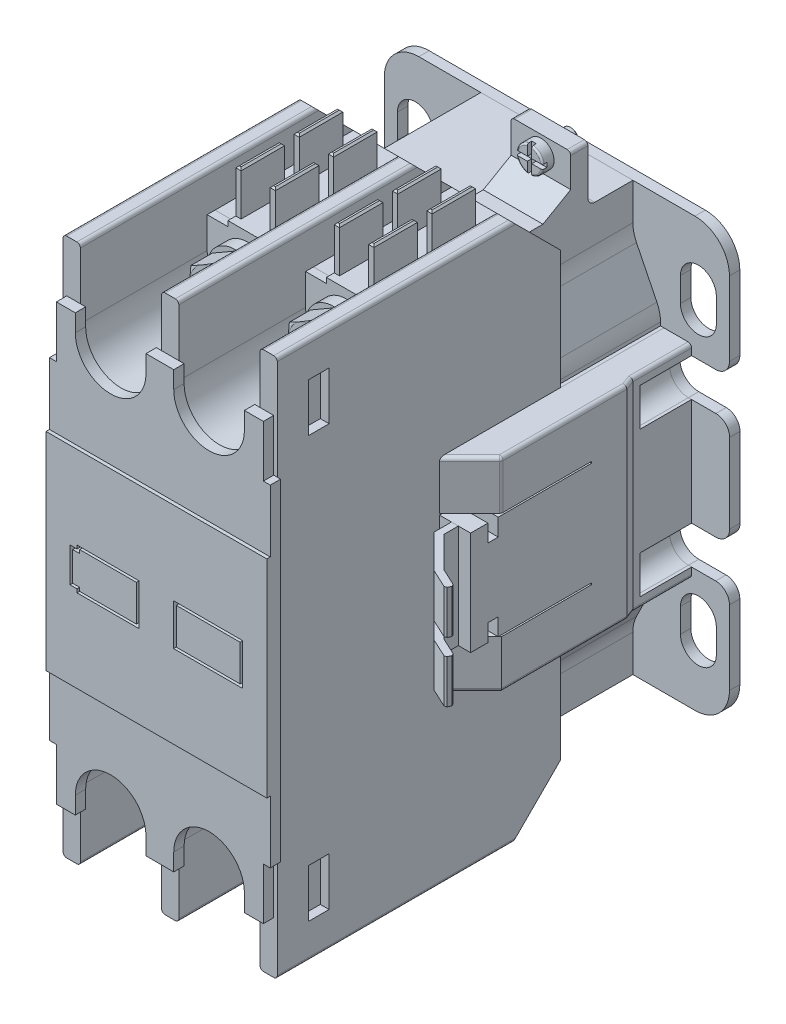
from build123d import *

# Parameters (mm, degrees)
BOSS_EXTRUDE1_DEPTH       = 27.75025
BOSS_EXTRUDE1_DEPTH_BACK  = 13.24975
BOSS_EXTRUDE2_START       = -29.75
BOSS_EXTRUDE2_DEPTH       = 1.50114
BOSS_EXTRUDE3_START       = -13.24975
BOSS_EXTRUDE3_DEPTH       = 14.99911
BOSS_EXTRUDE4_DEPTH       = 21.5011
CUT_EXTRUDE4_START        = -1.27
CUT_EXTRUDE4_DEPTH        = 1.27
SKETCH16_W                = 5.7404
SKETCH16_H                = 0.889
CUT_EXTRUDE5_DEPTH        = 14.732
BOSS_EXTRUDE5_DEPTH       = 1.143
SKETCH10_R                = 4.0005
BOSS_EXTRUDE6_DEPTH       = 1.84912
BOSS_EXTRUDE7_DEPTH       = 3.2258
SKETCH12_OUTSIDE_W        = 559.38
SKETCH12_OUTSIDE_H        = 587.34
SKETCH12_OUTSIDE_R        = 3.288568281
CUT_EXTRUDE3_DEPTH        = 65.048728331
CUT_EXTRUDE3_DRAFT        = -75
SKETCH13_W                = 6.577136562
SKETCH13_H                = 0.762
SKETCH13_W_2              = 0.762
SKETCH13_H_2              = 3.556
CUT_EXTRUDE_THIN1_DEPTH   = 1.27
CUT_EXTRUDE1_DEPTH        = 56.063220588
CUT_EXTRUDE1_DEPTH_BACK   = 56.063220588
SKETCH17_W                = 5.7404
SKETCH17_H                = 1.651
BOSS_EXTRUDE9_DEPTH       = 15.875
SKETCH18_W                = 0.762
SKETCH18_H                = 6.2992
BOSS_EXTRUDE10_DEPTH      = 6.2992
CHAMFER1_SIZE             = 0.254
BOSS_EXTRUDE11_DEPTH      = 15.9889
BOSS_EXTRUDE11_DEPTH_BACK = 15.9889
SKETCH20_W                = 1
SKETCH20_H                = 7.493
CUT_EXTRUDE6_DEPTH        = 76.843305776
BOSS_EXTRUDE12_DEPTH      = 14.732
CUT_EXTRUDE7_DEPTH        = 7.23392
CUT_EXTRUDE8_DEPTH        = 7.493
CUT_EXTRUDE9_DEPTH        = 68.509757213
SKETCH26_R                = 0.75
CUT_EXTRUDE10_DEPTH       = 63.278475094
CUT_EXTRUDE11_DEPTH       = 63.278475094
CUT_EXTRUDE11_DEPTH_BACK  = 63.278475094
SKETCH27_W                = 9.396731614
SKETCH27_H                = 2.405095086
FILLET4_R                 = 0.508
SKETCH28_W                = 10
SKETCH28_H                = 6
CUT_EXTRUDE12_DEPTH       = 7.493
BOSS_EXTRUDE18_REACH      = 78.333
SKETCH36_W                = 1
SKETCH36_H                = 0.5
SKETCH29_W                = 9.238
SKETCH29_H                = 5.238
BOSS_EXTRUDE13_DEPTH      = 7.112
BOSS_EXTRUDE13_2_DEPTH    = 7.112
BOSS_EXTRUDE14_DEPTH      = 8.636
BOSS_EXTRUDE15_DEPTH      = 1.651
BOSS_EXTRUDE15_DEPTH_BACK = 2.481599
SKETCH31_R                = 1.905
SKETCH33_R                = 1.651
BOSS_EXTRUDE16_DEPTH      = 0.635
SKETCH34_R                = 1.143
BOSS_EXTRUDE17_DEPTH      = 1.27
FILLET1_R                 = 0.254
CHAMFER2_SIZE             = 0.127
SKETCH32_W                = 0.635
SKETCH32_H                = 3.81
SKETCH32_W_2              = 3.81
SKETCH32_H_2              = 0.635
CUT_EXTRUDE_THIN2_DEPTH   = 0.635
FILLET2_R                 = 0.508
FILLET3_R                 = 0.508
SKETCH35_W                = 2.99974
SKETCH35_H                = 7.00024
CUT_EXTRUDE13_DEPTH       = 1.27


with BuildPart() as part:
    # Sketch4 → Boss-Extrude1 (new, two sides: drawn at the far end of the back side and taken through both)
    with BuildSketch(Plane.XY.offset(-BOSS_EXTRUDE1_DEPTH_BACK)):
        with BuildLine():
            Line((-15.5063, -38.9993), (-15.5063, 38.9993))
            Line((-15.5063, 38.9993), (-13.0063, 38.9993))
            Line((-13.0063, 38.9993), (-13.0063, 28.9993))
            ThreePointArc((-13.0063, 28.9993), (-7.12815, 23.12115), (-1.25, 28.9993))
            Line((-1.25, 28.9993), (-1.25, 38.9993))
            Line((-1.25, 38.9993), (1.25, 38.9993))
            Line((1.25, 38.9993), (1.25, 28.9993))
            ThreePointArc((1.25, 28.9993), (7.12815, 23.12115), (13.0063, 28.9993))
            Line((13.0063, 28.9993), (13.0063, 38.9993))
            Line((13.0063, 38.9993), (15.5063, 38.9993))
            Line((15.5063, 38.9993), (15.5063, -38.9993))
            Line((15.5063, -38.9993), (13.0063, -38.9993))
            Line((13.0063, -38.9993), (13.0063, -28.9993))
            ThreePointArc((13.0063, -28.9993), (7.12815, -23.12115), (1.25, -28.9993))
            Line((1.25, -28.9993), (1.25, -38.9993))
            Line((1.25, -38.9993), (-1.25, -38.9993))
            Line((-1.25, -38.9993), (-1.25, -28.9993))
            ThreePointArc((-1.25, -28.9993), (-7.12815, -23.12115), (-13.0063, -28.9993))
            Line((-13.0063, -28.9993), (-13.0063, -38.9993))
            Line((-13.0063, -38.9993), (-15.5063, -38.9993))
        make_face()
    extrude(amount=BOSS_EXTRUDE1_DEPTH + BOSS_EXTRUDE1_DEPTH_BACK)

    # Sketch7 → Boss-Extrude3 (add)
    with BuildSketch(Plane.XY.offset(BOSS_EXTRUDE3_START)):
        with BuildLine():
            Line((11.0063, -30.9993), (-11.0063, -30.9993))
            Line((-11.0063, -30.9993), (-11.0063, -25.666452457))
            ThreePointArc((-11.0063, -25.666452457), (-11.137198656, -24.529855738), (-11.523040841, -23.452770611))
            Line((-11.523040841, -23.452770611), (-14.489559159, -17.444829389))
            ThreePointArc((-14.489559159, -17.444829389), (-14.875401344, -16.367744262), (-15.0063, -15.231147543))
            Line((-15.0063, -15.231147543), (-15.0063, -14.731147543))
            Line((-15.0063, -14.731147543), (-15.5063, -14.731147543))
            Line((-15.5063, -14.731147543), (-15.5063, 14.731147543))
            Line((-15.5063, 14.731147543), (-15.0063, 14.731147543))
            Line((-15.0063, 14.731147543), (-15.0063, 15.231147543))
            ThreePointArc((-15.0063, 15.231147543), (-14.875401344, 16.367744262), (-14.489559159, 17.444829389))
            Line((-14.489559159, 17.444829389), (-11.523040841, 23.452770611))
            ThreePointArc((-11.523040841, 23.452770611), (-11.137198656, 24.529855738), (-11.0063, 25.666452457))
            Line((-11.0063, 25.666452457), (-11.0063, 30.9993))
            Line((-11.0063, 30.9993), (11.0063, 30.9993))
            Line((11.0063, 30.9993), (11.0063, 25.666452457))
            ThreePointArc((11.0063, 25.666452457), (11.137198656, 24.529855738), (11.523040841, 23.452770611))
            Line((11.523040841, 23.452770611), (14.489559159, 17.444829389))
            ThreePointArc((14.489559159, 17.444829389), (14.875401344, 16.367744262), (15.0063, 15.231147543))
            Line((15.0063, 15.231147543), (15.0063, 14.731147543))
            Line((15.0063, 14.731147543), (15.5063, 14.731147543))
            Line((15.5063, 14.731147543), (15.5063, -14.731147543))
            Line((15.5063, -14.731147543), (15.0063, -14.731147543))
            Line((15.0063, -14.731147543), (15.0063, -15.231147543))
            ThreePointArc((15.0063, -15.231147543), (14.875401344, -16.367744262), (14.489559159, -17.444829389))
            Line((14.489559159, -17.444829389), (11.523040841, -23.452770611))
            ThreePointArc((11.523040841, -23.452770611), (11.137198656, -24.529855738), (11.0063, -25.666452457))
            Line((11.0063, -25.666452457), (11.0063, -30.9993))
        make_face()
    extrude(amount=-BOSS_EXTRUDE3_DEPTH)

    # Sketch8 → Boss-Extrude4 (add)
    with BuildSketch(Plane.XY.offset(-13.249749999)):
        with BuildLine():
            Line((1.25, 28.9993), (1.25, 33.5002))
            Line((1.25, 33.5002), (13.0063, 33.5002))
            Line((13.0063, 33.5002), (13.0063, 28.9993))
            ThreePointArc((13.0063, 28.9993), (7.12815, 23.12115), (1.25, 28.9993))
        make_face()
        with BuildLine():
            Line((13.0063, -33.5002), (1.25, -33.5002))
            Line((1.25, -33.5002), (1.25, -28.9993))
            ThreePointArc((1.25, -28.9993), (7.12815, -23.12115), (13.0063, -28.9993))
            Line((13.0063, -28.9993), (13.0063, -33.5002))
        make_face()
        with BuildLine():
            Line((-1.25, -28.9993), (-1.25, -33.5002))
            Line((-1.25, -33.5002), (-13.0063, -33.5002))
            Line((-13.0063, -33.5002), (-13.0063, -28.9993))
            ThreePointArc((-13.0063, -28.9993), (-7.12815, -23.12115), (-1.25, -28.9993))
        make_face()
        with BuildLine():
            Line((-13.0063, 33.5002), (-1.25, 33.5002))
            Line((-1.25, 33.5002), (-1.25, 28.9993))
            ThreePointArc((-1.25, 28.9993), (-7.12815, 23.12115), (-13.0063, 28.9993))
            Line((-13.0063, 28.9993), (-13.0063, 33.5002))
        make_face()
    extrude(amount=BOSS_EXTRUDE4_DEPTH)

    # Sketch15 → Cut-Extrude4 (cut)
    with BuildSketch(Plane.XY.offset(8.251350001).offset(CUT_EXTRUDE4_START)):
        with BuildLine():
            Line((-9.99835, 33.5002), (-4.25795, 33.5002))
            Line((-4.25795, 33.5002), (-4.25795, 23.869524237))
            ThreePointArc((-4.25795, 23.869524237), (-7.12815, 23.12115), (-9.99835, 23.869524237))
            Line((-9.99835, 23.869524237), (-9.99835, 33.5002))
        make_face()
        with BuildLine():
            Line((9.99835, 33.5002), (4.25795, 33.5002))
            Line((4.25795, 33.5002), (4.25795, 23.869524237))
            ThreePointArc((4.25795, 23.869524237), (7.12815, 23.12115), (9.99835, 23.869524237))
            Line((9.99835, 23.869524237), (9.99835, 33.5002))
        make_face()
        with BuildLine():
            Line((9.99835, -33.5002), (9.99835, -23.869524237))
            ThreePointArc((9.99835, -23.869524237), (7.12815, -23.12115), (4.25795, -23.869524237))
            Line((4.25795, -23.869524237), (4.25795, -33.5002))
            Line((4.25795, -33.5002), (9.99835, -33.5002))
        make_face()
        with BuildLine():
            Line((-9.99835, -33.5002), (-4.25795, -33.5002))
            Line((-4.25795, -33.5002), (-4.25795, -23.869524237))
            ThreePointArc((-4.25795, -23.869524237), (-7.12815, -23.12115), (-9.99835, -23.869524237))
            Line((-9.99835, -23.869524237), (-9.99835, -33.5002))
        make_face()
    extrude(amount=CUT_EXTRUDE4_DEPTH, mode=Mode.SUBTRACT)

    # Sketch16 → Cut-Extrude5 (cut)
    with BuildSketch(Plane.XY.offset(8.251350001)):
        with Locations((-7.12815, 33.0557)):
            Rectangle(SKETCH16_W, SKETCH16_H)
        with Locations((7.12815, 33.0557)):
            Rectangle(SKETCH16_W, SKETCH16_H)
        with Locations((7.12815, -33.0557)):
            Rectangle(SKETCH16_W, SKETCH16_H)
        with Locations((-7.12815, -33.0557)):
            Rectangle(SKETCH16_W, SKETCH16_H)
    extrude(amount=-CUT_EXTRUDE5_DEPTH, mode=Mode.SUBTRACT)

    # Sketch6 → Cut-Extrude1 (cut, two sides: drawn at the far end of the back side and taken through both)
    with BuildSketch(Plane(origin=(0, 0, 0), x_dir=(0, 0, -1), z_dir=(1, 0, 0)).offset(-CUT_EXTRUDE1_DEPTH_BACK)):
        Polygon((13.249749999, 31.99916693), (13.249749999, 39.5073), (6.249749999, 39.5073), (6.249749999, 38.99916693), align=None)
        Polygon((13.249749999, -39.5073), (6.249749999, -39.5073), (6.249749999, -38.99916693), (13.249749999, -31.99916693), align=None)
    extrude(amount=CUT_EXTRUDE1_DEPTH + CUT_EXTRUDE1_DEPTH_BACK, mode=Mode.SUBTRACT)


with BuildPart() as body_2:
    # Sketch5 → Boss-Extrude2 (new body)
    with BuildSketch(Plane.XY.offset(BOSS_EXTRUDE2_START)):
        with BuildLine():
            Line((19.9937, 30.9993), (-19.9937, 30.9993))
            ThreePointArc((-19.9937, 30.9993), (-23.529233906, 29.534833906), (-24.9937, 25.9993))
            Line((-24.9937, 25.9993), (-24.9937, 15.257233919))
            ThreePointArc((-24.9937, 15.257233919), (-24.407913562, 13.843020357), (-22.9937, 13.257233919))
            Line((-22.9937, 13.257233919), (-19.052007326, 13.257233919))
            ThreePointArc((-19.052007326, 13.257233919), (-16.302007326, 10.507233919), (-19.052007326, 7.757233919))
            Line((-19.052007326, 7.757233919), (-23.019, 7.757233919))
            ThreePointArc((-23.019, 7.757233919), (-24.433213562, 7.171447482), (-25.019, 5.757233919))
            Line((-25.019, 5.757233919), (-25.019, -5.757233919))
            ThreePointArc((-25.019, -5.757233919), (-24.433213562, -7.171447482), (-23.019, -7.757233919))
            Line((-23.019, -7.757233919), (-19.052007326, -7.757233919))
            ThreePointArc((-19.052007326, -7.757233919), (-16.302007326, -10.507233919), (-19.052007326, -13.257233919))
            Line((-19.052007326, -13.257233919), (-22.9937, -13.257233919))
            ThreePointArc((-22.9937, -13.257233919), (-24.407913562, -13.843020357), (-24.9937, -15.257233919))
            Line((-24.9937, -15.257233919), (-24.9937, -25.9993))
            ThreePointArc((-24.9937, -25.9993), (-23.529233906, -29.534833906), (-19.9937, -30.9993))
            Line((-19.9937, -30.9993), (19.9937, -30.9993))
            ThreePointArc((19.9937, -30.9993), (23.529233906, -29.534833906), (24.9937, -25.9993))
            Line((24.9937, -25.9993), (24.9937, -15.257233919))
            ThreePointArc((24.9937, -15.257233919), (24.407913562, -13.843020357), (22.9937, -13.257233919))
            Line((22.9937, -13.257233919), (19.052007326, -13.257233919))
            ThreePointArc((19.052007326, -13.257233919), (16.302007326, -10.507233919), (19.052007326, -7.757233919))
            Line((19.052007326, -7.757233919), (23.019, -7.757233919))
            ThreePointArc((23.019, -7.757233919), (24.433213562, -7.171447482), (25.019, -5.757233919))
            Line((25.019, -5.757233919), (25.019, 5.757233919))
            ThreePointArc((25.019, 5.757233919), (24.433213562, 7.171447482), (23.019, 7.757233919))
            Line((23.019, 7.757233919), (19.052007326, 7.757233919))
            ThreePointArc((19.052007326, 7.757233919), (16.302007326, 10.507233919), (19.052007326, 13.257233919))
            Line((19.052007326, 13.257233919), (22.9937, 13.257233919))
            ThreePointArc((22.9937, 13.257233919), (24.407913562, 13.843020357), (24.9937, 15.257233919))
            Line((24.9937, 15.257233919), (24.9937, 25.9993))
            ThreePointArc((24.9937, 25.9993), (23.529233906, 29.534833906), (19.9937, 30.9993))
        make_face()
        with BuildLine():
            Line((23.0937, 22.4983), (23.0937, 18.9983))
            ThreePointArc((23.0937, 18.9983), (20.4937, 16.3983), (17.8937, 18.9983))
            Line((17.8937, 18.9983), (17.8937, 22.4983))
            ThreePointArc((17.8937, 22.4983), (20.4937, 25.0983), (23.0937, 22.4983))
        make_face(mode=Mode.SUBTRACT)
        with BuildLine():
            Line((17.8937, -18.9983), (17.8937, -22.4983))
            ThreePointArc((17.8937, -22.4983), (20.4937, -25.0983), (23.0937, -22.4983))
            Line((23.0937, -22.4983), (23.0937, -18.9983))
            ThreePointArc((23.0937, -18.9983), (20.4937, -16.3983), (17.8937, -18.9983))
        make_face(mode=Mode.SUBTRACT)
        with BuildLine():
            Line((-23.0937, -22.4983), (-23.0937, -18.9983))
            ThreePointArc((-23.0937, -18.9983), (-20.4937, -16.3983), (-17.8937, -18.9983))
            Line((-17.8937, -18.9983), (-17.8937, -22.4983))
            ThreePointArc((-17.8937, -22.4983), (-20.4937, -25.0983), (-23.0937, -22.4983))
        make_face(mode=Mode.SUBTRACT)
        with BuildLine():
            Line((-17.8937, 18.9983), (-17.8937, 22.4983))
            ThreePointArc((-17.8937, 22.4983), (-20.4937, 25.0983), (-23.0937, 22.4983))
            Line((-23.0937, 22.4983), (-23.0937, 18.9983))
            ThreePointArc((-23.0937, 18.9983), (-20.4937, 16.3983), (-17.8937, 18.9983))
        make_face(mode=Mode.SUBTRACT)
    extrude(amount=BOSS_EXTRUDE2_DEPTH)


with BuildPart() as body_3:
    # Sketch9 → Boss-Extrude5 (new body)
    with BuildSketch(Plane.XY.offset(8.251350001)):
        with BuildLine():
            Line((-1.25, 33.5002), (-1.25, 28.9993))
            ThreePointArc((-1.25, 28.9993), (-7.12815, 23.12115), (-13.0063, 28.9993))
            Line((-13.0063, 28.9993), (-13.0063, 33.5002))
            Line((-13.0063, 33.5002), (-1.25, 33.5002))
        make_face()
    extrude(amount=BOSS_EXTRUDE5_DEPTH)

    # Sketch10 → Boss-Extrude6 (add)
    with BuildSketch(Plane.XY.offset(9.394350001)):
        with Locations((-7.12815, 28.9993)):
            Circle(SKETCH10_R)
    extrude(amount=BOSS_EXTRUDE6_DEPTH)

    # Sketch11 → Boss-Extrude7 (add)
    with BuildSketch(Plane.XY.offset(11.243470001)):
        Polygon((-3.839581719, 30.897955782), (-7.12815, 32.796611565), (-10.416718281, 30.897955782), (-10.416718281, 27.100644218), (-7.12815, 25.201988435), (-3.839581719, 27.100644218), align=None)
    extrude(amount=BOSS_EXTRUDE7_DEPTH)


with BuildPart() as cut_extrude3_tool:
    # Sketch12 outside → Cut-Extrude3 (with draft: the straight prism first)
    with BuildSketch(Plane.XY.offset(14.469270001)):
        Rectangle(SKETCH12_OUTSIDE_W, SKETCH12_OUTSIDE_H)
        with Locations((-7.12815, 28.9993)):
            Circle(SKETCH12_OUTSIDE_R, mode=Mode.SUBTRACT)
    extrude(amount=-CUT_EXTRUDE3_DEPTH)
    # Cut-Extrude3: the draft: its side faces are tilted about the plane it starts from
    cut_extrude3_sides = [cut_extrude3_tool.faces().sort_by_distance(p)[0] for p in [
        (0, -293.67, -18.055094165),
        (279.69, 0, -18.055094165),
        (0, 293.67, -18.055094165),
        (-279.69, 0, -18.055094165),
        (-10.416718281, 28.9993, -18.055094165),
    ]]
    draft(cut_extrude3_sides, Plane.XY.offset(14.469270001), CUT_EXTRUDE3_DRAFT)


with BuildPart() as body_3_1:
    add(body_3.part)

    # Cut-Extrude3: cut by cut_extrude3_tool
    add(cut_extrude3_tool.part, mode=Mode.SUBTRACT)

    # Sketch13 → Cut-Extrude-Thin1 (cut)
    with BuildSketch(Plane.XY.offset(14.469270001)):
        with Locations((-7.12815, 28.9993)):
            Rectangle(SKETCH13_W, SKETCH13_H)
        with Locations((-7.12815, 28.9993)):
            Rectangle(SKETCH13_W_2, SKETCH13_H_2)
    extrude(amount=-CUT_EXTRUDE_THIN1_DEPTH, mode=Mode.SUBTRACT)

    # Sketch17 → Boss-Extrude9 (add)
    with BuildSketch(Plane.XY.offset(-6.480649999)):
        with Locations((-7.12815, 33.4367)):
            Rectangle(SKETCH17_W, SKETCH17_H)
    extrude(amount=BOSS_EXTRUDE9_DEPTH)

    # Sketch18 → Boss-Extrude10 (add)
    with BuildSketch(Plane(origin=(0, 34.2622, 0), x_dir=(1, 0, 0), z_dir=(0, 1, 0))):
        with Locations((-9.61735, 3.331049999)):
            Rectangle(SKETCH18_W, SKETCH18_H)
        with Locations((-9.61735, -5.101750001)):
            Rectangle(SKETCH18_W, SKETCH18_H)
        with Locations((-4.63895, -5.101750001)):
            Rectangle(SKETCH18_W, SKETCH18_H)
        with Locations((-4.63895, 3.331049999)):
            Rectangle(SKETCH18_W, SKETCH18_H)
    extrude(amount=BOSS_EXTRUDE10_DEPTH)

    # Chamfer1
    chamfer1_edges = [body_3_1.edges().sort_by_distance(p)[0] for p in [
        (-9.99835, 40.5614, -3.331049999),
        (-9.61735, 40.5614, -0.181449999),
        (-9.23635, 40.5614, -3.331049999),
        (-9.61735, 40.5614, -6.480649999),
        (-9.99835, 40.5614, 5.101750001),
        (-9.61735, 40.5614, 8.251350001),
        (-9.23635, 40.5614, 5.101750001),
        (-9.61735, 40.5614, 1.952150001),
        (-4.63895, 40.5614, 1.952150001),
        (-5.01995, 40.5614, 5.101750001),
        (-4.63895, 40.5614, 8.251350001),
        (-4.25795, 40.5614, 5.101750001),
        (-4.63895, 40.5614, -0.181449999),
        (-4.25795, 40.5614, -3.331049999),
        (-4.63895, 40.5614, -6.480649999),
        (-5.01995, 40.5614, -3.331049999),
    ]]
    chamfer(chamfer1_edges, length=CHAMFER1_SIZE)


with BuildPart() as body_4:
    # Mirror1: mirrored copy
    add(body_3_1.part.mirror(Plane.ZX))


with BuildPart() as body_5:
    # Mirror8: mirrored copy
    add(body_3_1.part.mirror(Plane(origin=(0, 0, 0), x_dir=(0, 0, 1), z_dir=(1, 0, 0))))


with BuildPart() as body_6:
    # Mirror8 2: mirrored copy
    add(body_4.part.mirror(Plane(origin=(0, 0, 0), x_dir=(0, 0, 1), z_dir=(1, 0, 0))))


with BuildPart() as body_7:
    # Sketch19 → Boss-Extrude11 (new, two sides: drawn at the far end of the back side and taken through both)
    with BuildSketch(Plane(origin=(0, 0, 0), x_dir=(0, 0, -1), z_dir=(1, 0, 0)).offset(-BOSS_EXTRUDE11_DEPTH_BACK)):
        Polygon((-27.75025, 31.4993), (-29.25025, 31.4993), (-29.25025, 14.9993), (-29.75, 14.9993), (-29.75, -14.9993), (-29.25025, -14.9993), (-29.25025, -31.4993), (-27.75025, -31.4993), align=None)
    extrude(amount=BOSS_EXTRUDE11_DEPTH + BOSS_EXTRUDE11_DEPTH_BACK)

    # Sketch20 → Cut-Extrude6 (cut, through all)
    with BuildSketch(Plane.XY.offset(29.25025)):
        with BuildLine():
            Line((-2.012, 28.9993), (-2.012, 31.4993))
            Line((-2.012, 31.4993), (-12.2443, 31.4993))
            Line((-12.2443, 31.4993), (-12.2443, 28.9993))
            ThreePointArc((-12.2443, 28.9993), (-7.12815, 23.88315), (-2.012, 28.9993))
        make_face()
        with BuildLine():
            Line((12.2443, 31.4993), (12.2443, 28.9993))
            ThreePointArc((12.2443, 28.9993), (7.12815, 23.88315), (2.012, 28.9993))
            Line((2.012, 28.9993), (2.012, 31.4993))
            Line((2.012, 31.4993), (12.2443, 31.4993))
        make_face()
        with BuildLine():
            Line((2.012, -28.9993), (2.012, -31.4993))
            Line((2.012, -31.4993), (12.2443, -31.4993))
            Line((12.2443, -31.4993), (12.2443, -28.9993))
            ThreePointArc((12.2443, -28.9993), (7.12815, -23.88315), (2.012, -28.9993))
        make_face()
        with BuildLine():
            Line((-12.2443, -31.4993), (-12.2443, -28.9993))
            ThreePointArc((-12.2443, -28.9993), (-7.12815, -23.88315), (-2.012, -28.9993))
            Line((-2.012, -28.9993), (-2.012, -31.4993))
            Line((-2.012, -31.4993), (-12.2443, -31.4993))
        make_face()
        with Locations((-15.4889, 27.7528)):
            Rectangle(SKETCH20_W, SKETCH20_H)
        with Locations((15.4889, 27.7528)):
            Rectangle(SKETCH20_W, SKETCH20_H)
        with Locations((15.4889, -27.7528)):
            Rectangle(SKETCH20_W, SKETCH20_H)
        with Locations((-15.4889, -27.7528)):
            Rectangle(SKETCH20_W, SKETCH20_H)
    extrude(amount=-CUT_EXTRUDE6_DEPTH, mode=Mode.SUBTRACT)


with BuildPart() as body_8:
    # Sketch21 → Boss-Extrude12 (new, symmetric)
    with BuildSketch(Plane(origin=(0, 0, 0), x_dir=(1, 0, 0), z_dir=(0, 1, 0))):
        Polygon((-15.5063, 28.24886), (-15.5063, -4.25114), (-17.234111412, -4.25114), (-17.234111412, -6.75114), (-22.104472317, -11.621500905), (-24.779723152, -12.868990857), (-25.111954664, -12.748068475), (-25.323263795, -12.294914582), (-25.202341414, -11.96268307), (-22.686897094, -10.78971212), (-18.234111412, -6.336926438), (-18.234111412, -4.25114), (-20.006300099, -4.25114), (-20.006300099, 18.37512129), (-19.506300099, 19.74886), (-19.506300099, 28.24886), align=None)
    extrude(amount=BOSS_EXTRUDE12_DEPTH, both=True)

    # Sketch22 → Cut-Extrude7 (cut)
    with BuildSketch(Plane(origin=(0, 14.732, 0), x_dir=(1, 0, 0), z_dir=(0, 1, 0))):
        Polygon((-15.5063, -4.25114), (-20.006300099, 0.24975), (-20.006300099, -4.25114), (-18.234111412, -4.25114), (-18.234111412, -6.336926438), (-22.686897094, -10.78971212), (-25.202341414, -11.96268307), (-25.323263795, -12.294914582), (-25.111954664, -12.748068475), (-24.779723152, -12.868990857), (-22.104472317, -11.621500905), (-17.234111412, -6.75114), (-17.234111412, -4.25114), align=None)
    cut_extrude7 = extrude(amount=-CUT_EXTRUDE7_DEPTH, mode=Mode.SUBTRACT)

    # Sketch23 → Cut-Extrude8 (cut)
    with BuildSketch(Plane(origin=(0, 0, -28.24886), x_dir=(-1, 0, 0), z_dir=(0, 0, -1))):
        with BuildLine():
            Line((19.506300099, 13.257233919), (19.052007326, 13.257233919))
            ThreePointArc((19.052007326, 13.257233919), (16.302007326, 10.507233919), (19.052007326, 7.757233919))
            Line((19.052007326, 7.757233919), (19.506300099, 7.757233919))
            Line((19.506300099, 7.757233919), (19.506300099, 13.257233919))
        make_face()
        with BuildLine():
            Line((19.506300099, -7.757233919), (19.052007326, -7.757233919))
            ThreePointArc((19.052007326, -7.757233919), (16.302007326, -10.507233919), (19.052007326, -13.257233919))
            Line((19.052007326, -13.257233919), (19.506300099, -13.257233919))
            Line((19.506300099, -13.257233919), (19.506300099, -7.757233919))
        make_face()
    cut_extrude8 = extrude(amount=-CUT_EXTRUDE8_DEPTH, mode=Mode.SUBTRACT)

    # Sketch24 → Cut-Extrude9 (cut, through all)
    with BuildSketch(Plane.ZY.offset(20.006300099)):
        Polygon((4.25114, 7.49808), (1.75114, 7.49808), (1.75114, 4.99808), (0.25114, 4.99808), (0.25114, 7.49808), (-13.24886, 7.49808), (-13.24886, 7.731775085), (4.25114, 7.731775085), align=None)
    cut_extrude9 = extrude(amount=-CUT_EXTRUDE9_DEPTH, mode=Mode.SUBTRACT)

    # Sketch26 → Cut-Extrude10 (cut, through all)
    with BuildSketch(Plane(origin=(-5.948592487, 0, -5.948592487), x_dir=(-0.7071067811865531, 0, 0.7071067811865419), z_dir=(-0.7071067811865419, 0, -0.7071067811865531))):
        with Locations((20.373718089, 4.247452457)):
            Circle(SKETCH26_R)
    cut_extrude10 = extrude(amount=-CUT_EXTRUDE10_DEPTH, mode=Mode.SUBTRACT)

    # Sketch27 → Cut-Extrude11 (cut, two sides: drawn at the far end of the back side and taken through both)
    with BuildSketch(Plane(origin=(-5.948592487, 0, -5.948592487), x_dir=(-0.7071067811865531, 0, 0.7071067811865419), z_dir=(-0.7071067811865419, 0, -0.7071067811865531)).offset(-CUT_EXTRUDE11_DEPTH_BACK)):
        with Locations((22.072713291, 0)):
            Rectangle(SKETCH27_W, SKETCH27_H)
    extrude(amount=CUT_EXTRUDE11_DEPTH + CUT_EXTRUDE11_DEPTH_BACK, mode=Mode.SUBTRACT)

    # Mirror2: Cut-Extrude7, Cut-Extrude8, Cut-Extrude9, Cut-Extrude10 across plane
    add(cut_extrude7.mirror(Plane.ZX), mode=Mode.SUBTRACT)
    add(cut_extrude8.mirror(Plane.ZX), mode=Mode.SUBTRACT)
    add(cut_extrude9.mirror(Plane.ZX), mode=Mode.SUBTRACT)
    add(cut_extrude10.mirror(Plane.ZX), mode=Mode.SUBTRACT)

    # Fillet4
    fillet4_edges = [body_8.edges().sort_by_distance(p)[0] for p in [
        (-17.75630005, -14.732, 2.000695),
        (-20.006300099, -14.732, -9.312435645),
        (-19.756300099, -14.732, -19.061990645),
        (-19.506300099, -14.732, -23.99886),
        (-17.75630005, 14.732, 2.000695),
        (-19.506300099, 14.732, -23.99886),
        (-19.756300099, 14.732, -19.061990645),
        (-20.006300099, 14.732, -9.312435645),
        (-20.006300099, 11.231887543, -0.24975),
    ]]
    fillet(fillet4_edges, radius=FILLET4_R)


with BuildPart() as body_9:
    # Split1: read off the stored shape, not the designer's step
    # Split1: the piece on the far side of the plane
    add(body_8.part)
    split(bisect_by=Plane.XY.offset(4.25114), keep=Keep.BOTTOM)


with BuildPart() as body_8_1:
    add(body_8.part)

    # Split1
    split(bisect_by=Plane.XY.offset(4.25114), keep=Keep.TOP)


with BuildPart() as body_10:
    # Mirror4: mirrored copy
    add(body_8_1.part.mirror(Plane(origin=(0, 0, 0), x_dir=(0, 0, 1), z_dir=(1, 0, 0))))


with BuildPart() as body_11:
    # Mirror4 2: mirrored copy
    add(body_9.part.mirror(Plane(origin=(0, 0, 0), x_dir=(0, 0, 1), z_dir=(1, 0, 0))))


with BuildPart() as body_9_1:
    add(body_9.part)

    # Combine1: union body 11, part
    add(body_11.part)
    add(part.part)


with BuildPart() as cut_extrude12_tool:
    # Sketch28 → Cut-Extrude12 (new body)
    with BuildSketch(Plane.XY.offset(29.75)):
        with Locations((7.49936, 0)):
            Rectangle(SKETCH28_W, SKETCH28_H)
        with Locations((-7.49936, 0)):
            Rectangle(SKETCH28_W, SKETCH28_H)
    extrude(amount=-CUT_EXTRUDE12_DEPTH)


with BuildPart() as body_7_1:
    add(body_7.part)

    # Cut-Extrude12: cut by cut_extrude12_tool
    add(cut_extrude12_tool.part, mode=Mode.SUBTRACT)



with BuildPart() as body_9_2:
    add(body_9_1.part)

    # Cut-Extrude12: cut by cut_extrude12_tool
    add(cut_extrude12_tool.part, mode=Mode.SUBTRACT)


with BuildPart() as body_7_2:
    add(body_7_1.part)

    # Boss-Extrude18: up to this face of the body (flat: up to its plane)
    boss_extrude18_end = Plane(body_9_2.part.faces().sort_by_distance((-7.49936, 0, 22.257))[0])
    # Sketch36 → Boss-Extrude18 (add, up to the picked face)
    with BuildSketch(Plane.XY.offset(29.75), mode=Mode.PRIVATE) as boss_extrude18_sk1:
        with Locations((-11.99936, 2.75)):
            Rectangle(SKETCH36_W, SKETCH36_H)
    boss_extrude18_tool1 = split(extrude(boss_extrude18_sk1.sketch, amount=-BOSS_EXTRUDE18_REACH, mode=Mode.PRIVATE), bisect_by=boss_extrude18_end, keep=Keep.BOTH, mode=Mode.PRIVATE)
    # Sketch36 → Boss-Extrude18 (add, up to the picked face)
    with BuildSketch(Plane.XY.offset(29.75), mode=Mode.PRIVATE) as boss_extrude18_sk2:
        with Locations((-11.99936, -2.75)):
            Rectangle(SKETCH36_W, SKETCH36_H)
    boss_extrude18_tool2 = split(extrude(boss_extrude18_sk2.sketch, amount=-BOSS_EXTRUDE18_REACH, mode=Mode.PRIVATE), bisect_by=boss_extrude18_end, keep=Keep.BOTH, mode=Mode.PRIVATE)
    add(boss_extrude18_tool1.solids().sort_by(Axis((-11.99936, 2.75, 29.75), (0, 0, -1)))[0])
    add(boss_extrude18_tool2.solids().sort_by(Axis((-11.99936, -2.75, 29.75), (0, 0, -1)))[0])


with BuildPart() as body_10_2:
    # Sketch29 → Boss-Extrude13 (new body)
    with BuildSketch(Plane.XY.offset(29.75)):
        with Locations((7.49936, 0)):
            Rectangle(SKETCH29_W, SKETCH29_H)
    extrude(amount=-BOSS_EXTRUDE13_DEPTH)


with BuildPart() as body_11_2:
    # Sketch29 → Boss-Extrude13 2 (new body)
    with BuildSketch(Plane.XY.offset(29.75)):
        Polygon((-2.88036, 2.619), (-11.11836, 2.619), (-11.11836, 2.119), (-12.11836, 2.119), (-12.11836, -2.119), (-11.11836, -2.119), (-11.11836, -2.619), (-2.88036, -2.619), align=None)
    extrude(amount=-BOSS_EXTRUDE13_2_DEPTH)


with BuildPart() as body_12:
    # Sketch30 → Boss-Extrude14 (new body)
    with BuildSketch(Plane.ZY.offset(-11.0063)):
        with BuildLine():
            Line((-13.249749999, 31.99916693), (-15.222127944, 31.99916693))
            Line((-15.222127944, 31.99916693), (-19.24975, 34.324515609))
            Line((-19.24975, 34.324515609), (-19.24975, 39.101915464))
            Line((-19.24975, 39.101915464), (-21.731349441, 39.101915464))
            Line((-21.731349441, 39.101915464), (-21.731349441, 31.999300001))
            ThreePointArc((-21.731349441, 31.999300001), (-22.024242659, 31.29219322), (-22.731349441, 30.999300001))
            Line((-22.731349441, 30.999300001), (-13.249749999, 30.999300001))
            Line((-13.249749999, 30.999300001), (-13.249749999, 31.99916693))
        make_face()
    extrude(amount=BOSS_EXTRUDE14_DEPTH)

    # Fillet2
    fillet2_edges = [body_12.edges().sort_by_distance(p)[0] for p in [
        (2.3703, 39.101915464, -20.49054972),
        (11.0063, 39.101915464, -20.49054972),
    ]]
    fillet(fillet2_edges, radius=FILLET2_R)


with BuildPart() as body_13:
    # Sketch31 → Boss-Extrude15 (new, two sides: drawn at the far end of the back side and taken through both)
    with BuildSketch(Plane.XY.offset(-19.24975).offset(-BOSS_EXTRUDE15_DEPTH_BACK)):
        with Locations((6.6883, 36.713215536)):
            Circle(SKETCH31_R)
    extrude(amount=BOSS_EXTRUDE15_DEPTH + BOSS_EXTRUDE15_DEPTH_BACK)


with BuildPart() as boss_extrude16_tool:
    # Sketch33 → Boss-Extrude16 (new body)
    with BuildSketch(Plane(origin=(0, 0, -21.731349441), x_dir=(-1, 0, 0), z_dir=(0, 0, -1))):
        with Locations((-6.6883, 36.713215536)):
            Circle(SKETCH33_R)
    extrude(amount=BOSS_EXTRUDE16_DEPTH)


with BuildPart() as body_13_1:
    add(body_13.part)


with BuildPart() as body_13_2:
    # Boss-Extrude16: joined with boss_extrude16_tool
    add(body_13_1.part.fuse(boss_extrude16_tool.part, tol=0.00001))

    # Sketch34 → Boss-Extrude17 (add)
    with BuildSketch(Plane(origin=(0, 0, -22.366349441), x_dir=(-1, 0, 0), z_dir=(0, 0, -1))):
        with Locations((-6.6883, 36.713215536)):
            Circle(SKETCH34_R)
    extrude(amount=BOSS_EXTRUDE17_DEPTH)

    # Fillet1
    fillet1_edges = [body_13_2.edges().sort_by_distance(p)[0] for p in [
        (4.7833, 36.713215536, -17.59875),
    ]]
    fillet(fillet1_edges, radius=FILLET1_R)

    # Chamfer2
    chamfer2_edges = [body_13_2.edges().sort_by_distance(p)[0] for p in [
        (7.8313, 36.713215536, -23.636349441),
    ]]
    chamfer(chamfer2_edges, length=CHAMFER2_SIZE)

    # Sketch32 → Cut-Extrude-Thin2 (cut)
    with BuildSketch(Plane.XY.offset(-17.59875)):
        with Locations((6.6883, 36.713215536)):
            Rectangle(SKETCH32_W, SKETCH32_H)
        with Locations((6.6883, 36.713215536)):
            Rectangle(SKETCH32_W_2, SKETCH32_H_2)
    extrude(amount=-CUT_EXTRUDE_THIN2_DEPTH, mode=Mode.SUBTRACT)


with BuildPart() as body_14:
    # Mirror5: mirrored copy
    add(body_13_2.part.mirror(Plane.ZX))


with BuildPart() as body_15:
    # Mirror5 2: mirrored copy
    add(body_12.part.mirror(Plane.ZX))


with BuildPart() as body_16:
    # Mirror6: mirrored copy
    add(body_12.part.mirror(Plane(origin=(0, 0, 0), x_dir=(0, 0, 1), z_dir=(1, 0, 0))))


with BuildPart() as body_17:
    # Mirror6 2: mirrored copy
    add(body_13_2.part.mirror(Plane(origin=(0, 0, 0), x_dir=(0, 0, 1), z_dir=(1, 0, 0))))


with BuildPart() as body_18:
    # Mirror6 3: mirrored copy
    add(body_14.part.mirror(Plane(origin=(0, 0, 0), x_dir=(0, 0, 1), z_dir=(1, 0, 0))))


with BuildPart() as body_19:
    # Mirror6 4: mirrored copy
    add(body_15.part.mirror(Plane(origin=(0, 0, 0), x_dir=(0, 0, 1), z_dir=(1, 0, 0))))


with BuildPart() as body_9_3:
    add(body_9_2.part)

    # Fillet3
    fillet3_edges = [body_9_3.edges().sort_by_distance(p)[0] for p in [
        (-15.5063, -38.9993, 10.75025),
        (-13.0063, -38.9993, 10.75025),
        (-1.25, -38.9993, 10.75025),
        (1.25, -38.9993, 10.75025),
        (13.0063, -38.9993, 10.75025),
        (15.5063, -38.9993, 10.75025),
        (-15.5063, 38.9993, 10.75025),
        (-13.0063, 38.9993, 10.75025),
        (-1.25, 38.9993, 10.75025),
        (1.25, 38.9993, 10.75025),
        (13.0063, 38.9993, 10.75025),
        (15.5063, 38.9993, 10.75025),
    ]]
    fillet(fillet3_edges, radius=FILLET3_R)

    # Sketch35 → Cut-Extrude13 (cut)
    with BuildSketch(Plane(origin=(15.5063, 0, 0), x_dir=(0, 0, -1), z_dir=(1, 0, 0))):
        with Locations((-21.75077, 30.4649)):
            Rectangle(SKETCH35_W, SKETCH35_H)
        with Locations((-21.75077, -30.4649)):
            Rectangle(SKETCH35_W, SKETCH35_H)
    cut_extrude13 = extrude(amount=-CUT_EXTRUDE13_DEPTH, mode=Mode.SUBTRACT)

    # Mirror7: Cut-Extrude13 across plane
    add(cut_extrude13.mirror(Plane(origin=(0, 0, 0), x_dir=(0, 0, 1), z_dir=(1, 0, 0))), mode=Mode.SUBTRACT)

    # Combine2: union body 19, body 12
    add(body_19.part)
    add(body_12.part)


solid = Compound([body_2.part, body_3_1.part, body_4.part, body_5.part, body_6.part, body_8_1.part, body_10.part, body_7_2.part, body_10_2.part, body_11_2.part, body_13_2.part, body_18.part, body_9_3.part])
